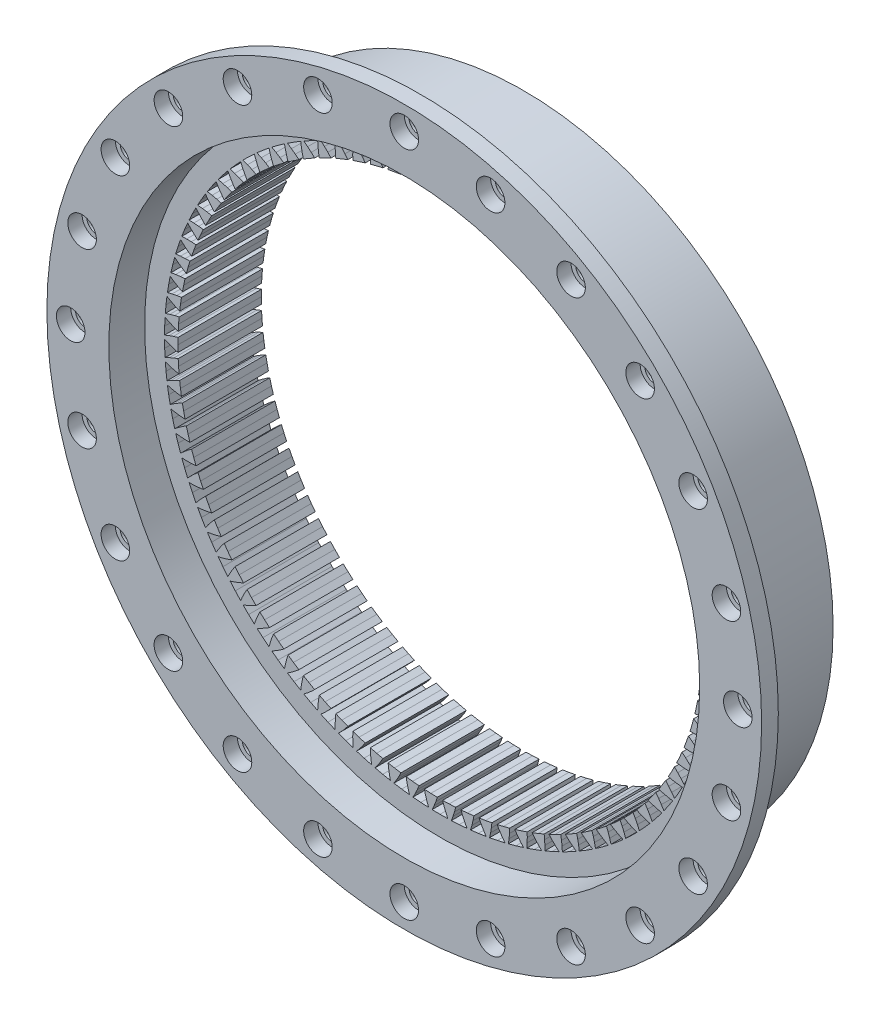
from build123d import *

# Parameters (mm, degrees)
SKETCH_1_R               = 65
F_01_BODY_D130_DEPTH     = 21.5
SKETCH_2_R               = 75
F_02_FLANGE_D150_DEPTH   = 3.5
F_03_TEETH_Z90_DEPTH     = 17.5
SKETCH_4_R               = 62
F_04_BORE_D124_DEPTH     = 108.5
SKETCH_5_R               = 2
F_05_HOLES_24_D4_DEPTH   = 3.5
SKETCH_6_R               = 3
F_06_CBORE_24_D6X3_DEPTH = 3


with BuildPart() as part:
    # 草图1 → 01_BODY_D130 (new body)
    with BuildSketch(Plane.XY):
        Circle(SKETCH_1_R)
    extrude(amount=F_01_BODY_D130_DEPTH)

    # 草图2 → 02_FLANGE_D150 (add)
    with BuildSketch(Plane.XY.offset(21.5)):
        Circle(SKETCH_2_R)
    extrude(amount=F_02_FLANGE_D150_DEPTH)

    # 草图3 → 03_TEETH_Z90 (cut)
    with BuildSketch(Plane.XY):
        Polygon((57.811326154, -0.368408161), (56.870010675, -0.753333148), (55.926939158, -1.086914302), (54.983085214, -1.363942953), (55, 0), (54.983085214, 1.363942953), (55.926939158, 1.086914302), (56.870010675, 0.753333148), (57.811326154, 0.368408161), (57.777282187, 2.017627153), (57.696199523, 3.665203518), (56.784028051, 3.21555334), (55.866523254, 2.81699943), (54.944293032, 2.474805683), (54.866022764, 3.836606056), (54.754005331, 5.196046597), (55.714884636, 4.985532696), (56.678928323, 4.718549473), (57.644801815, 4.400224992), (57.495797076, 6.043051783), (57.299982808, 7.680958694), (56.421399351, 7.168773976), (55.533931264, 6.707189023), (54.637817778, 6.301497315), (54.464743781, 7.654520553), (54.258169438, 9.002835624), (55.231392796, 8.859862076), (56.21171193, 8.660777499), (57.197437796, 8.410604369), (56.934198221, 10.039035271), (56.624606336, 11.659293011), (55.783891264, 11.087069065), (54.930783544, 10.564701866), (54.065152568, 10.097488686), (53.79811804, 11.435142995), (53.497993197, 12.76576374), (54.478819163, 12.691027099), (55.470637727, 12.560811087), (56.471413609, 12.380008127), (56.095221675, 13.986109589), (55.673360474, 15.580824424), (54.874609666, 14.951349068), (54.060018568, 14.370744543), (53.22908737, 13.844286106), (52.869393277, 15.16005457), (52.477180111, 16.466498339), (53.460830199, 16.460362714), (54.459316153, 16.399649667), (55.470266372, 16.289097731), (54.982954848, 17.865044987), (54.450879597, 19.426447627), (53.697984486, 18.742787602), (52.925878615, 18.106774398), (52.133695408, 17.523635557), (51.683094143, 18.811107883), (51.200703479, 20.087009814), (52.182385444, 20.149505095), (53.182674264, 20.158590802), (54.198873573, 20.118828487), (53.602816592, 21.656943682), (52.963119507, 23.17742713), (52.259748124, 22.442913158), (51.533889102, 21.754589867), (50.784313322, 21.117611616), (50.24500017, 22.370515369), (49.674782166, 23.609659395), (50.649713353, 23.740481114), (51.646931733, 23.819321309), (52.66342931, 23.850542333), (51.961530802, 25.343331924), (51.217328422, 26.815488538), (50.566907521, 26.033699098), (49.890831661, 25.296419162), (49.187515167, 24.608704795), (48.562117607, 25.820935953), (47.906850308, 27.01728509), (48.870280949, 27.215795895), (49.859570541, 27.364006477), (50.871414113, 27.466058735), (50.067093656, 28.90625), (49.222011662, 30.322907581), (48.627710029, 29.497651472), (48.004711104, 28.715006845), (47.351080383, 27.979906837), (46.642645289, 29.145559533), (45.90552109, 30.293285287), (46.852757449, 30.558518054), (47.829298534, 30.775376956), (48.8315585, 30.947763259), (47.928734663, 32.328339732), (46.986890209, 33.682596466), (46.451603221, 32.817894253), (45.884716419, 31.993697901), (45.283955894, 31.214793586), (44.495934691, 32.328188876), (43.680544788, 33.421699643), (44.606972025, 33.752362184), (45.566006992, 34.036812891), (46.553800442, 34.278693391), (45.556871693, 35.592929042), (44.52285335, 36.878187127), (44.049188871, 35.978251553), (43.541176008, 35.116518877), (42.996212524, 34.297604998), (42.132444372, 35.353318533), (41.242761263, 36.387286838), (42.143865916, 36.781768199), (43.080722444, 37.132424896), (44.049236949, 37.442621175), (42.963060223, 38.68411318), (41.841905625, 39.894110968), (41.432171301, 38.963326427), (40.985507365, 38.068255703), (40.498995929, 37.213321926), (39.563689019, 38.206210375), (38.60404715, 39.175598829), (39.475439129, 39.631977137), (40.385552947, 40.04713146), (41.33007, 40.424132273), (40.159937042, 41.586832207), (38.957108342, 42.715674709), (38.613300357, 41.758575892), (38.23016145, 40.834527814), (37.804472297, 39.94773929), (36.80218335, 40.872965401), (35.777258001, 41.773051241), (36.614691971, 42.289103066), (37.493629096, 42.766732424), (38.409547106, 43.208701061), (37.161158685, 44.286944368), (35.882515943, 45.329131978), (35.606309295, 44.350381772), (35.28856203, 43.40185821), (34.925769075, 42.487535284), (33.861381143, 43.340591448), (32.776165646, 44.166989546), (33.575561714, 44.740200735), (34.419040052, 45.277978167), (35.301896758, 45.782761401), (33.981334898, 46.771294987), (32.633107533, 47.721750272), (32.425847874, 46.726117051), (32.175040284, 45.757739115), (31.876911018, 44.820336277), (30.755609691, 45.597066491), (29.615391107, 46.345750717), (30.372854695, 46.973328644), (31.176764906, 47.568634151), (32.022259118, 48.13377273), (30.635957463, 49.027780559), (29.224713903, 49.881872996), (29.087410981, 48.874207384), (28.904764976, 47.890692916), (28.672751854, 46.934777097), (27.5, 47.631397208), (26.31033336, 48.29872005), (27.022174182, 48.977607217), (27.782599694, 49.627540532), (28.586612251, 50.250281156), (27.141324724, 51.045407712), (25.673940405, 51.798976248), (25.607263146, 50.784187492), (25.493668558, 49.790328074), (25.328901925, 48.820556401), (24.110413073, 49.433672546), (22.877094313, 50.016382874), (23.539844352, 50.743271812), (24.253080449, 51.444666524), (25.011694282, 52.121975264), (23.514462178, 52.81434677), (21.99808605, 53.463720095), (22.002359298, 52.446752143), (21.95836955, 51.447389758), (21.861652132, 50.468486861), (20.603362638, 50.995112001), (19.332400363, 51.490370908), (19.942830766, 52.261720286), (20.605402635, 53.011159271), (21.314921853, 53.739736347), (19.773039536, 54.325979639), (18.215059231, 54.867994072), (18.290262168, 53.853801489), (18.316091573, 52.853804932), (18.287894568, 51.870539927), (16.995934691, 52.308108396), (15.693520901, 52.71350303), (16.248657714, 53.525554913), (16.85733737, 54.319386979), (17.514305267, 55.095682837), (15.935284633, 55.572941796), (14.343290474, 56.004956697), (14.489056719, 54.998480528), (14.584579438, 54.00272168), (14.625040219, 53.019884936), (13.305704258, 53.366264945), (11.978184182, 53.679820265), (12.475322834, 54.528618417), (13.027144851, 55.362976094), (13.628360747, 56.183208698), (12.019894625, 56.549158167), (10.401642648, 56.869068803), (10.617262042, 55.875212498), (10.782012699, 54.888542597), (10.890934145, 53.910922395), (9.550649772, 54.164426416), (8.204490955, 54.384614811), (8.641209436, 55.266023973), (9.133485393, 56.136842355), (9.676020222, 56.997015614), (8.045944899, 57.249872724), (6.409319064, 57.456120521), (6.693741132, 56.47972605), (6.926917077, 55.506952052), (7.103768534, 54.539311259), (5.74906548, 54.698704245), (4.390826272, 54.824452981), (4.764996934, 55.734179015), (5.195328512, 56.637215562), (5.6765391, 57.533138799), (4.032796138, 57.671671656), (2.385769923, 57.763251797), (2.737608988, 56.809076053), (3.038074212, 55.854937215), (3.281994077, 54.901990081), (1.919472319, 54.966495486), (0.555769925, 54.997191926), (0.865569846, 55.93080274), (1.231860512, 56.861657949), (1.64940245, 57.788966315), (0, 57.8125), (-1.64940245, 57.788966315), (-1.231860512, 56.861657949), (-0.865569846, 55.93080274), (-0.555769925, 54.997191926), (-1.919472319, 54.966495486), (-3.281994077, 54.901990081), (-3.038074212, 55.854937215), (-2.737608988, 56.809076053), (-2.385769923, 57.763251797), (-4.032796138, 57.671671656), (-5.6765391, 57.533138799), (-5.195328512, 56.637215562), (-4.764996934, 55.734179015), (-4.390826272, 54.824452981), (-5.74906548, 54.698704245), (-7.103768534, 54.539311259), (-6.926917077, 55.506952052), (-6.693741132, 56.47972605), (-6.409319064, 57.456120521), (-8.045944899, 57.249872724), (-9.676020222, 56.997015614), (-9.133485393, 56.136842355), (-8.641209436, 55.266023973), (-8.204490955, 54.384614811), (-9.550649772, 54.164426416), (-10.890934145, 53.910922395), (-10.782012699, 54.888542597), (-10.617262042, 55.875212498), (-10.401642648, 56.869068803), (-12.019894625, 56.549158167), (-13.628360747, 56.183208698), (-13.027144851, 55.362976094), (-12.475322834, 54.528618417), (-11.978184182, 53.679820265), (-13.305704258, 53.366264945), (-14.625040219, 53.019884936), (-14.584579438, 54.00272168), (-14.489056719, 54.998480528), (-14.343290474, 56.004956697), (-15.935284633, 55.572941796), (-17.514305267, 55.095682837), (-16.85733737, 54.319386979), (-16.248657714, 53.525554913), (-15.693520901, 52.71350303), (-16.995934691, 52.308108396), (-18.287894568, 51.870539927), (-18.316091573, 52.853804932), (-18.290262168, 53.853801489), (-18.215059231, 54.867994072), (-19.773039536, 54.325979639), (-21.314921853, 53.739736347), (-20.605402635, 53.011159271), (-19.942830766, 52.261720286), (-19.332400363, 51.490370908), (-20.603362638, 50.995112001), (-21.861652132, 50.468486861), (-21.95836955, 51.447389758), (-22.002359298, 52.446752143), (-21.99808605, 53.463720095), (-23.514462178, 52.81434677), (-25.011694282, 52.121975264), (-24.253080449, 51.444666524), (-23.539844352, 50.743271812), (-22.877094313, 50.016382874), (-24.110413073, 49.433672546), (-25.328901925, 48.820556401), (-25.493668558, 49.790328074), (-25.607263146, 50.784187492), (-25.673940405, 51.798976248), (-27.141324724, 51.045407712), (-28.586612251, 50.250281156), (-27.782599694, 49.627540532), (-27.022174182, 48.977607217), (-26.31033336, 48.29872005), (-27.5, 47.631397208), (-28.672751854, 46.934777097), (-28.904764976, 47.890692916), (-29.087410981, 48.874207384), (-29.224713903, 49.881872996), (-30.635957463, 49.027780559), (-32.022259118, 48.13377273), (-31.176764906, 47.568634151), (-30.372854695, 46.973328644), (-29.615391107, 46.345750717), (-30.755609691, 45.597066491), (-31.876911018, 44.820336277), (-32.175040284, 45.757739115), (-32.425847874, 46.726117051), (-32.633107533, 47.721750272), (-33.981334898, 46.771294987), (-35.301896758, 45.782761401), (-34.419040052, 45.277978167), (-33.575561714, 44.740200735), (-32.776165646, 44.166989546), (-33.861381143, 43.340591448), (-34.925769075, 42.487535284), (-35.28856203, 43.40185821), (-35.606309295, 44.350381772), (-35.882515943, 45.329131978), (-37.161158685, 44.286944368), (-38.409547106, 43.208701061), (-37.493629096, 42.766732424), (-36.614691971, 42.289103066), (-35.777258001, 41.773051241), (-36.80218335, 40.872965401), (-37.804472297, 39.94773929), (-38.23016145, 40.834527814), (-38.613300357, 41.758575892), (-38.957108342, 42.715674709), (-40.159937042, 41.586832207), (-41.33007, 40.424132273), (-40.385552947, 40.04713146), (-39.475439129, 39.631977137), (-38.60404715, 39.175598829), (-39.563689019, 38.206210375), (-40.498995929, 37.213321926), (-40.985507365, 38.068255703), (-41.432171301, 38.963326427), (-41.841905625, 39.894110968), (-42.963060223, 38.68411318), (-44.049236949, 37.442621175), (-43.080722444, 37.132424896), (-42.143865916, 36.781768199), (-41.242761263, 36.387286838), (-42.132444372, 35.353318533), (-42.996212524, 34.297604998), (-43.541176008, 35.116518877), (-44.049188871, 35.978251553), (-44.52285335, 36.878187127), (-45.556871693, 35.592929042), (-46.553800442, 34.278693391), (-45.566006992, 34.036812891), (-44.606972025, 33.752362184), (-43.680544788, 33.421699643), (-44.495934691, 32.328188876), (-45.283955894, 31.214793586), (-45.884716419, 31.993697901), (-46.451603221, 32.817894253), (-46.986890209, 33.682596466), (-47.928734663, 32.328339732), (-48.8315585, 30.947763259), (-47.829298534, 30.775376956), (-46.852757449, 30.558518054), (-45.90552109, 30.293285287), (-46.642645289, 29.145559533), (-47.351080383, 27.979906837), (-48.004711104, 28.715006845), (-48.627710029, 29.497651472), (-49.222011662, 30.322907581), (-50.067093656, 28.90625), (-50.871414113, 27.466058735), (-49.859570541, 27.364006477), (-48.870280949, 27.215795895), (-47.906850308, 27.01728509), (-48.562117607, 25.820935953), (-49.187515167, 24.608704795), (-49.890831661, 25.296419162), (-50.566907521, 26.033699098), (-51.217328422, 26.815488538), (-51.961530802, 25.343331924), (-52.66342931, 23.850542333), (-51.646931733, 23.819321309), (-50.649713353, 23.740481114), (-49.674782166, 23.609659395), (-50.24500017, 22.370515369), (-50.784313322, 21.117611616), (-51.533889102, 21.754589867), (-52.259748124, 22.442913158), (-52.963119507, 23.17742713), (-53.602816592, 21.656943682), (-54.198873573, 20.118828487), (-53.182674264, 20.158590802), (-52.182385444, 20.149505095), (-51.200703479, 20.087009814), (-51.683094143, 18.811107883), (-52.133695408, 17.523635557), (-52.925878615, 18.106774398), (-53.697984486, 18.742787602), (-54.450879597, 19.426447627), (-54.982954848, 17.865044987), (-55.470266372, 16.289097731), (-54.459316153, 16.399649667), (-53.460830199, 16.460362714), (-52.477180111, 16.466498339), (-52.869393277, 15.16005457), (-53.22908737, 13.844286106), (-54.060018568, 14.370744543), (-54.874609666, 14.951349068), (-55.673360474, 15.580824424), (-56.095221675, 13.986109589), (-56.471413609, 12.380008127), (-55.470637727, 12.560811087), (-54.478819163, 12.691027099), (-53.497993197, 12.76576374), (-53.79811804, 11.435142995), (-54.065152568, 10.097488686), (-54.930783544, 10.564701866), (-55.783891264, 11.087069065), (-56.624606336, 11.659293011), (-56.934198221, 10.039035271), (-57.197437796, 8.410604369), (-56.21171193, 8.660777499), (-55.231392796, 8.859862076), (-54.258169438, 9.002835624), (-54.464743781, 7.654520553), (-54.637817778, 6.301497315), (-55.533931264, 6.707189023), (-56.421399351, 7.168773976), (-57.299982808, 7.680958694), (-57.495797076, 6.043051783), (-57.644801815, 4.400224992), (-56.678928323, 4.718549473), (-55.714884636, 4.985532696), (-54.754005331, 5.196046597), (-54.866022764, 3.836606056), (-54.944293032, 2.474805683), (-55.866523254, 2.81699943), (-56.784028051, 3.21555334), (-57.696199523, 3.665203518), (-57.777282187, 2.017627153), (-57.811326154, 0.368408161), (-56.870010675, 0.753333148), (-55.926939158, 1.086914302), (-54.983085214, 1.363942953), (-55, 0), (-54.983085214, -1.363942953), (-55.926939158, -1.086914302), (-56.870010675, -0.753333148), (-57.811326154, -0.368408161), (-57.777282187, -2.017627153), (-57.696199523, -3.665203518), (-56.784028051, -3.21555334), (-55.866523254, -2.81699943), (-54.944293032, -2.474805683), (-54.866022764, -3.836606056), (-54.754005331, -5.196046597), (-55.714884636, -4.985532696), (-56.678928323, -4.718549473), (-57.644801815, -4.400224992), (-57.495797076, -6.043051783), (-57.299982808, -7.680958694), (-56.421399351, -7.168773976), (-55.533931264, -6.707189023), (-54.637817778, -6.301497315), (-54.464743781, -7.654520553), (-54.258169438, -9.002835624), (-55.231392796, -8.859862076), (-56.21171193, -8.660777499), (-57.197437796, -8.410604369), (-56.934198221, -10.039035271), (-56.624606336, -11.659293011), (-55.783891264, -11.087069065), (-54.930783544, -10.564701866), (-54.065152568, -10.097488686), (-53.79811804, -11.435142995), (-53.497993197, -12.76576374), (-54.478819163, -12.691027099), (-55.470637727, -12.560811087), (-56.471413609, -12.380008127), (-56.095221675, -13.986109589), (-55.673360474, -15.580824424), (-54.874609666, -14.951349068), (-54.060018568, -14.370744543), (-53.22908737, -13.844286106), (-52.869393277, -15.16005457), (-52.477180111, -16.466498339), (-53.460830199, -16.460362714), (-54.459316153, -16.399649667), (-55.470266372, -16.289097731), (-54.982954848, -17.865044987), (-54.450879597, -19.426447627), (-53.697984486, -18.742787602), (-52.925878615, -18.106774398), (-52.133695408, -17.523635557), (-51.683094143, -18.811107883), (-51.200703479, -20.087009814), (-52.182385444, -20.149505095), (-53.182674264, -20.158590802), (-54.198873573, -20.118828487), (-53.602816592, -21.656943682), (-52.963119507, -23.17742713), (-52.259748124, -22.442913158), (-51.533889102, -21.754589867), (-50.784313322, -21.117611616), (-50.24500017, -22.370515369), (-49.674782166, -23.609659395), (-50.649713353, -23.740481114), (-51.646931733, -23.819321309), (-52.66342931, -23.850542333), (-51.961530802, -25.343331924), (-51.217328422, -26.815488538), (-50.566907521, -26.033699098), (-49.890831661, -25.296419162), (-49.187515167, -24.608704795), (-48.562117607, -25.820935953), (-47.906850308, -27.01728509), (-48.870280949, -27.215795895), (-49.859570541, -27.364006477), (-50.871414113, -27.466058735), (-50.067093656, -28.90625), (-49.222011662, -30.322907581), (-48.627710029, -29.497651472), (-48.004711104, -28.715006845), (-47.351080383, -27.979906837), (-46.642645289, -29.145559533), (-45.90552109, -30.293285287), (-46.852757449, -30.558518054), (-47.829298534, -30.775376956), (-48.8315585, -30.947763259), (-47.928734663, -32.328339732), (-46.986890209, -33.682596466), (-46.451603221, -32.817894253), (-45.884716419, -31.993697901), (-45.283955894, -31.214793586), (-44.495934691, -32.328188876), (-43.680544788, -33.421699643), (-44.606972025, -33.752362184), (-45.566006992, -34.036812891), (-46.553800442, -34.278693391), (-45.556871693, -35.592929042), (-44.52285335, -36.878187127), (-44.049188871, -35.978251553), (-43.541176008, -35.116518877), (-42.996212524, -34.297604998), (-42.132444372, -35.353318533), (-41.242761263, -36.387286838), (-42.143865916, -36.781768199), (-43.080722444, -37.132424896), (-44.049236949, -37.442621175), (-42.963060223, -38.68411318), (-41.841905625, -39.894110968), (-41.432171301, -38.963326427), (-40.985507365, -38.068255703), (-40.498995929, -37.213321926), (-39.563689019, -38.206210375), (-38.60404715, -39.175598829), (-39.475439129, -39.631977137), (-40.385552947, -40.04713146), (-41.33007, -40.424132273), (-40.159937042, -41.586832207), (-38.957108342, -42.715674709), (-38.613300357, -41.758575892), (-38.23016145, -40.834527814), (-37.804472297, -39.94773929), (-36.80218335, -40.872965401), (-35.777258001, -41.773051241), (-36.614691971, -42.289103066), (-37.493629096, -42.766732424), (-38.409547106, -43.208701061), (-37.161158685, -44.286944368), (-35.882515943, -45.329131978), (-35.606309295, -44.350381772), (-35.28856203, -43.40185821), (-34.925769075, -42.487535284), (-33.861381143, -43.340591448), (-32.776165646, -44.166989546), (-33.575561714, -44.740200735), (-34.419040052, -45.277978167), (-35.301896758, -45.782761401), (-33.981334898, -46.771294987), (-32.633107533, -47.721750272), (-32.425847874, -46.726117051), (-32.175040284, -45.757739115), (-31.876911018, -44.820336277), (-30.755609691, -45.597066491), (-29.615391107, -46.345750717), (-30.372854695, -46.973328644), (-31.176764906, -47.568634151), (-32.022259118, -48.13377273), (-30.635957463, -49.027780559), (-29.224713903, -49.881872996), (-29.087410981, -48.874207384), (-28.904764976, -47.890692916), (-28.672751854, -46.934777097), (-27.5, -47.631397208), (-26.31033336, -48.29872005), (-27.022174182, -48.977607217), (-27.782599694, -49.627540532), (-28.586612251, -50.250281156), (-27.141324724, -51.045407712), (-25.673940405, -51.798976248), (-25.607263146, -50.784187492), (-25.493668558, -49.790328074), (-25.328901925, -48.820556401), (-24.110413073, -49.433672546), (-22.877094313, -50.016382874), (-23.539844352, -50.743271812), (-24.253080449, -51.444666524), (-25.011694282, -52.121975264), (-23.514462178, -52.81434677), (-21.99808605, -53.463720095), (-22.002359298, -52.446752143), (-21.95836955, -51.447389758), (-21.861652132, -50.468486861), (-20.603362638, -50.995112001), (-19.332400363, -51.490370908), (-19.942830766, -52.261720286), (-20.605402635, -53.011159271), (-21.314921853, -53.739736347), (-19.773039536, -54.325979639), (-18.215059231, -54.867994072), (-18.290262168, -53.853801489), (-18.316091573, -52.853804932), (-18.287894568, -51.870539927), (-16.995934691, -52.308108396), (-15.693520901, -52.71350303), (-16.248657714, -53.525554913), (-16.85733737, -54.319386979), (-17.514305267, -55.095682837), (-15.935284633, -55.572941796), (-14.343290474, -56.004956697), (-14.489056719, -54.998480528), (-14.584579438, -54.00272168), (-14.625040219, -53.019884936), (-13.305704258, -53.366264945), (-11.978184182, -53.679820265), (-12.475322834, -54.528618417), (-13.027144851, -55.362976094), (-13.628360747, -56.183208698), (-12.019894625, -56.549158167), (-10.401642648, -56.869068803), (-10.617262042, -55.875212498), (-10.782012699, -54.888542597), (-10.890934145, -53.910922395), (-9.550649772, -54.164426416), (-8.204490955, -54.384614811), (-8.641209436, -55.266023973), (-9.133485393, -56.136842355), (-9.676020222, -56.997015614), (-8.045944899, -57.249872724), (-6.409319064, -57.456120521), (-6.693741132, -56.47972605), (-6.926917077, -55.506952052), (-7.103768534, -54.539311259), (-5.74906548, -54.698704245), (-4.390826272, -54.824452981), (-4.764996934, -55.734179015), (-5.195328512, -56.637215562), (-5.6765391, -57.533138799), (-4.032796138, -57.671671656), (-2.385769923, -57.763251797), (-2.737608988, -56.809076053), (-3.038074212, -55.854937215), (-3.281994077, -54.901990081), (-1.919472319, -54.966495486), (-0.555769925, -54.997191926), (-0.865569846, -55.93080274), (-1.231860512, -56.861657949), (-1.64940245, -57.788966315), (0, -57.8125), (1.64940245, -57.788966315), (1.231860512, -56.861657949), (0.865569846, -55.93080274), (0.555769925, -54.997191926), (1.919472319, -54.966495486), (3.281994077, -54.901990081), (3.038074212, -55.854937215), (2.737608988, -56.809076053), (2.385769923, -57.763251797), (4.032796138, -57.671671656), (5.6765391, -57.533138799), (5.195328512, -56.637215562), (4.764996934, -55.734179015), (4.390826272, -54.824452981), (5.74906548, -54.698704245), (7.103768534, -54.539311259), (6.926917077, -55.506952052), (6.693741132, -56.47972605), (6.409319064, -57.456120521), (8.045944899, -57.249872724), (9.676020222, -56.997015614), (9.133485393, -56.136842355), (8.641209436, -55.266023973), (8.204490955, -54.384614811), (9.550649772, -54.164426416), (10.890934145, -53.910922395), (10.782012699, -54.888542597), (10.617262042, -55.875212498), (10.401642648, -56.869068803), (12.019894625, -56.549158167), (13.628360747, -56.183208698), (13.027144851, -55.362976094), (12.475322834, -54.528618417), (11.978184182, -53.679820265), (13.305704258, -53.366264945), (14.625040219, -53.019884936), (14.584579438, -54.00272168), (14.489056719, -54.998480528), (14.343290474, -56.004956697), (15.935284633, -55.572941796), (17.514305267, -55.095682837), (16.85733737, -54.319386979), (16.248657714, -53.525554913), (15.693520901, -52.71350303), (16.995934691, -52.308108396), (18.287894568, -51.870539927), (18.316091573, -52.853804932), (18.290262168, -53.853801489), (18.215059231, -54.867994072), (19.773039536, -54.325979639), (21.314921853, -53.739736347), (20.605402635, -53.011159271), (19.942830766, -52.261720286), (19.332400363, -51.490370908), (20.603362638, -50.995112001), (21.861652132, -50.468486861), (21.95836955, -51.447389758), (22.002359298, -52.446752143), (21.99808605, -53.463720095), (23.514462178, -52.81434677), (25.011694282, -52.121975264), (24.253080449, -51.444666524), (23.539844352, -50.743271812), (22.877094313, -50.016382874), (24.110413073, -49.433672546), (25.328901925, -48.820556401), (25.493668558, -49.790328074), (25.607263146, -50.784187492), (25.673940405, -51.798976248), (27.141324724, -51.045407712), (28.586612251, -50.250281156), (27.782599694, -49.627540532), (27.022174182, -48.977607217), (26.31033336, -48.29872005), (27.5, -47.631397208), (28.672751854, -46.934777097), (28.904764976, -47.890692916), (29.087410981, -48.874207384), (29.224713903, -49.881872996), (30.635957463, -49.027780559), (32.022259118, -48.13377273), (31.176764906, -47.568634151), (30.372854695, -46.973328644), (29.615391107, -46.345750717), (30.755609691, -45.597066491), (31.876911018, -44.820336277), (32.175040284, -45.757739115), (32.425847874, -46.726117051), (32.633107533, -47.721750272), (33.981334898, -46.771294987), (35.301896758, -45.782761401), (34.419040052, -45.277978167), (33.575561714, -44.740200735), (32.776165646, -44.166989546), (33.861381143, -43.340591448), (34.925769075, -42.487535284), (35.28856203, -43.40185821), (35.606309295, -44.350381772), (35.882515943, -45.329131978), (37.161158685, -44.286944368), (38.409547106, -43.208701061), (37.493629096, -42.766732424), (36.614691971, -42.289103066), (35.777258001, -41.773051241), (36.80218335, -40.872965401), (37.804472297, -39.94773929), (38.23016145, -40.834527814), (38.613300357, -41.758575892), (38.957108342, -42.715674709), (40.159937042, -41.586832207), (41.33007, -40.424132273), (40.385552947, -40.04713146), (39.475439129, -39.631977137), (38.60404715, -39.175598829), (39.563689019, -38.206210375), (40.498995929, -37.213321926), (40.985507365, -38.068255703), (41.432171301, -38.963326427), (41.841905625, -39.894110968), (42.963060223, -38.68411318), (44.049236949, -37.442621175), (43.080722444, -37.132424896), (42.143865916, -36.781768199), (41.242761263, -36.387286838), (42.132444372, -35.353318533), (42.996212524, -34.297604998), (43.541176008, -35.116518877), (44.049188871, -35.978251553), (44.52285335, -36.878187127), (45.556871693, -35.592929042), (46.553800442, -34.278693391), (45.566006992, -34.036812891), (44.606972025, -33.752362184), (43.680544788, -33.421699643), (44.495934691, -32.328188876), (45.283955894, -31.214793586), (45.884716419, -31.993697901), (46.451603221, -32.817894253), (46.986890209, -33.682596466), (47.928734663, -32.328339732), (48.8315585, -30.947763259), (47.829298534, -30.775376956), (46.852757449, -30.558518054), (45.90552109, -30.293285287), (46.642645289, -29.145559533), (47.351080383, -27.979906837), (48.004711104, -28.715006845), (48.627710029, -29.497651472), (49.222011662, -30.322907581), (50.067093656, -28.90625), (50.871414113, -27.466058735), (49.859570541, -27.364006477), (48.870280949, -27.215795895), (47.906850308, -27.01728509), (48.562117607, -25.820935953), (49.187515167, -24.608704795), (49.890831661, -25.296419162), (50.566907521, -26.033699098), (51.217328422, -26.815488538), (51.961530802, -25.343331924), (52.66342931, -23.850542333), (51.646931733, -23.819321309), (50.649713353, -23.740481114), (49.674782166, -23.609659395), (50.24500017, -22.370515369), (50.784313322, -21.117611616), (51.533889102, -21.754589867), (52.259748124, -22.442913158), (52.963119507, -23.17742713), (53.602816592, -21.656943682), (54.198873573, -20.118828487), (53.182674264, -20.158590802), (52.182385444, -20.149505095), (51.200703479, -20.087009814), (51.683094143, -18.811107883), (52.133695408, -17.523635557), (52.925878615, -18.106774398), (53.697984486, -18.742787602), (54.450879597, -19.426447627), (54.982954848, -17.865044987), (55.470266372, -16.289097731), (54.459316153, -16.399649667), (53.460830199, -16.460362714), (52.477180111, -16.466498339), (52.869393277, -15.16005457), (53.22908737, -13.844286106), (54.060018568, -14.370744543), (54.874609666, -14.951349068), (55.673360474, -15.580824424), (56.095221675, -13.986109589), (56.471413609, -12.380008127), (55.470637727, -12.560811087), (54.478819163, -12.691027099), (53.497993197, -12.76576374), (53.79811804, -11.435142995), (54.065152568, -10.097488686), (54.930783544, -10.564701866), (55.783891264, -11.087069065), (56.624606336, -11.659293011), (56.934198221, -10.039035271), (57.197437796, -8.410604369), (56.21171193, -8.660777499), (55.231392796, -8.859862076), (54.258169438, -9.002835624), (54.464743781, -7.654520553), (54.637817778, -6.301497315), (55.533931264, -6.707189023), (56.421399351, -7.168773976), (57.299982808, -7.680958694), (57.495797076, -6.043051783), (57.644801815, -4.400224992), (56.678928323, -4.718549473), (55.714884636, -4.985532696), (54.754005331, -5.196046597), (54.866022764, -3.836606056), (54.944293032, -2.474805683), (55.866523254, -2.81699943), (56.784028051, -3.21555334), (57.696199523, -3.665203518), (57.777282187, -2.017627153), align=None)
    extrude(amount=F_03_TEETH_Z90_DEPTH, mode=Mode.SUBTRACT)

    # 草图4 → 04_BORE_D124 (cut, through all)
    with BuildSketch(Plane.XY.offset(17.5)):
        Circle(SKETCH_4_R)
    extrude(amount=F_04_BORE_D124_DEPTH, mode=Mode.SUBTRACT)

    # 草图5 → 05_HOLES_24_D4 (cut)
    with BuildSketch(Plane.XY.offset(25)):
        with Locations((0, 70)):
            Circle(SKETCH_5_R)
        with Locations((-18.117333157, 67.61480784)):
            Circle(SKETCH_5_R)
        with Locations((-35, 60.621778265)):
            Circle(SKETCH_5_R)
        with Locations((-49.497474683, 49.497474683)):
            Circle(SKETCH_5_R)
        with Locations((-60.621778265, 35)):
            Circle(SKETCH_5_R)
        with Locations((-67.61480784, 18.117333157)):
            Circle(SKETCH_5_R)
        with Locations((-70, 0)):
            Circle(SKETCH_5_R)
        with Locations((-67.61480784, -18.117333157)):
            Circle(SKETCH_5_R)
        with Locations((-60.621778265, -35)):
            Circle(SKETCH_5_R)
        with Locations((-49.497474683, -49.497474683)):
            Circle(SKETCH_5_R)
        with Locations((-35, -60.621778265)):
            Circle(SKETCH_5_R)
        with Locations((-18.117333157, -67.61480784)):
            Circle(SKETCH_5_R)
        with Locations((0, -70)):
            Circle(SKETCH_5_R)
        with Locations((18.117333157, -67.61480784)):
            Circle(SKETCH_5_R)
        with Locations((35, -60.621778265)):
            Circle(SKETCH_5_R)
        with Locations((49.497474683, -49.497474683)):
            Circle(SKETCH_5_R)
        with Locations((60.621778265, -35)):
            Circle(SKETCH_5_R)
        with Locations((67.61480784, -18.117333157)):
            Circle(SKETCH_5_R)
        with Locations((70, 0)):
            Circle(SKETCH_5_R)
        with Locations((67.61480784, 18.117333157)):
            Circle(SKETCH_5_R)
        with Locations((60.621778265, 35)):
            Circle(SKETCH_5_R)
        with Locations((49.497474683, 49.497474683)):
            Circle(SKETCH_5_R)
        with Locations((35, 60.621778265)):
            Circle(SKETCH_5_R)
        with Locations((18.117333157, 67.61480784)):
            Circle(SKETCH_5_R)
    extrude(amount=-F_05_HOLES_24_D4_DEPTH, mode=Mode.SUBTRACT)

    # 草图6 → 06_CBORE_24_D6X3 (cut)
    with BuildSketch(Plane.XY.offset(25)):
        with Locations((0, 70)):
            Circle(SKETCH_6_R)
        with Locations((-18.117333157, 67.61480784)):
            Circle(SKETCH_6_R)
        with Locations((-35, 60.621778265)):
            Circle(SKETCH_6_R)
        with Locations((-49.497474683, 49.497474683)):
            Circle(SKETCH_6_R)
        with Locations((-60.621778265, 35)):
            Circle(SKETCH_6_R)
        with Locations((-67.61480784, 18.117333157)):
            Circle(SKETCH_6_R)
        with Locations((-70, 0)):
            Circle(SKETCH_6_R)
        with Locations((-67.61480784, -18.117333157)):
            Circle(SKETCH_6_R)
        with Locations((-60.621778265, -35)):
            Circle(SKETCH_6_R)
        with Locations((-49.497474683, -49.497474683)):
            Circle(SKETCH_6_R)
        with Locations((-35, -60.621778265)):
            Circle(SKETCH_6_R)
        with Locations((-18.117333157, -67.61480784)):
            Circle(SKETCH_6_R)
        with Locations((0, -70)):
            Circle(SKETCH_6_R)
        with Locations((18.117333157, -67.61480784)):
            Circle(SKETCH_6_R)
        with Locations((35, -60.621778265)):
            Circle(SKETCH_6_R)
        with Locations((49.497474683, -49.497474683)):
            Circle(SKETCH_6_R)
        with Locations((60.621778265, -35)):
            Circle(SKETCH_6_R)
        with Locations((67.61480784, -18.117333157)):
            Circle(SKETCH_6_R)
        with Locations((70, 0)):
            Circle(SKETCH_6_R)
        with Locations((67.61480784, 18.117333157)):
            Circle(SKETCH_6_R)
        with Locations((60.621778265, 35)):
            Circle(SKETCH_6_R)
        with Locations((49.497474683, 49.497474683)):
            Circle(SKETCH_6_R)
        with Locations((35, 60.621778265)):
            Circle(SKETCH_6_R)
        with Locations((18.117333157, 67.61480784)):
            Circle(SKETCH_6_R)
    extrude(amount=-F_06_CBORE_24_D6X3_DEPTH, mode=Mode.SUBTRACT)


solid = part.part
